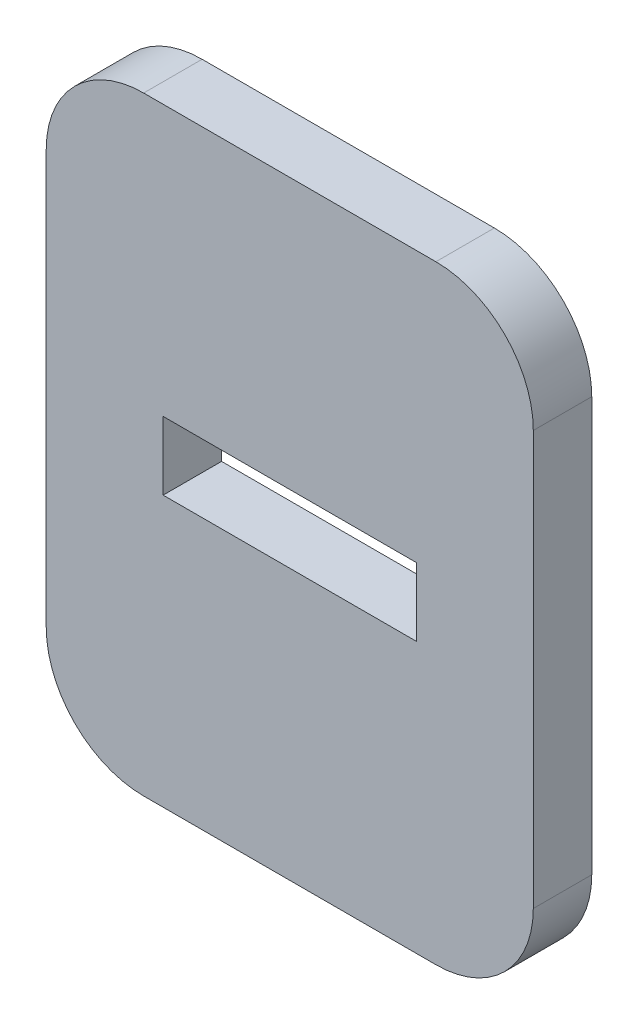
from build123d import *

# Parameters (mm, degrees)
SKETCH1_W           = 25.4
SKETCH1_H           = 31.75
SKETCH1_W_2         = 13.208
SKETCH1_H_2         = 3.556
BOSS_EXTRUDE1_DEPTH = 3.048
FILLET1_R           = 5.08


with BuildPart() as part:
    # Sketch1 → Boss-Extrude1 (new body)
    with BuildSketch(Plane.XY):
        with Locations((-135.757414923, 0)):
            Rectangle(SKETCH1_W, SKETCH1_H)
        with Locations((-135.757414923, 0)):
            Rectangle(SKETCH1_W_2, SKETCH1_H_2, mode=Mode.SUBTRACT)
    extrude(amount=-BOSS_EXTRUDE1_DEPTH)

    # Fillet1
    fillet1_edges = [part.edges().sort_by_distance(p)[0] for p in [
        (-148.457414923, -15.875, -1.524),
        (-123.057414923, -15.875, -1.524),
        (-123.057414923, 15.875, -1.524),
        (-148.457414923, 15.875, -1.524),
    ]]
    fillet(fillet1_edges, radius=FILLET1_R)


solid = part.part
